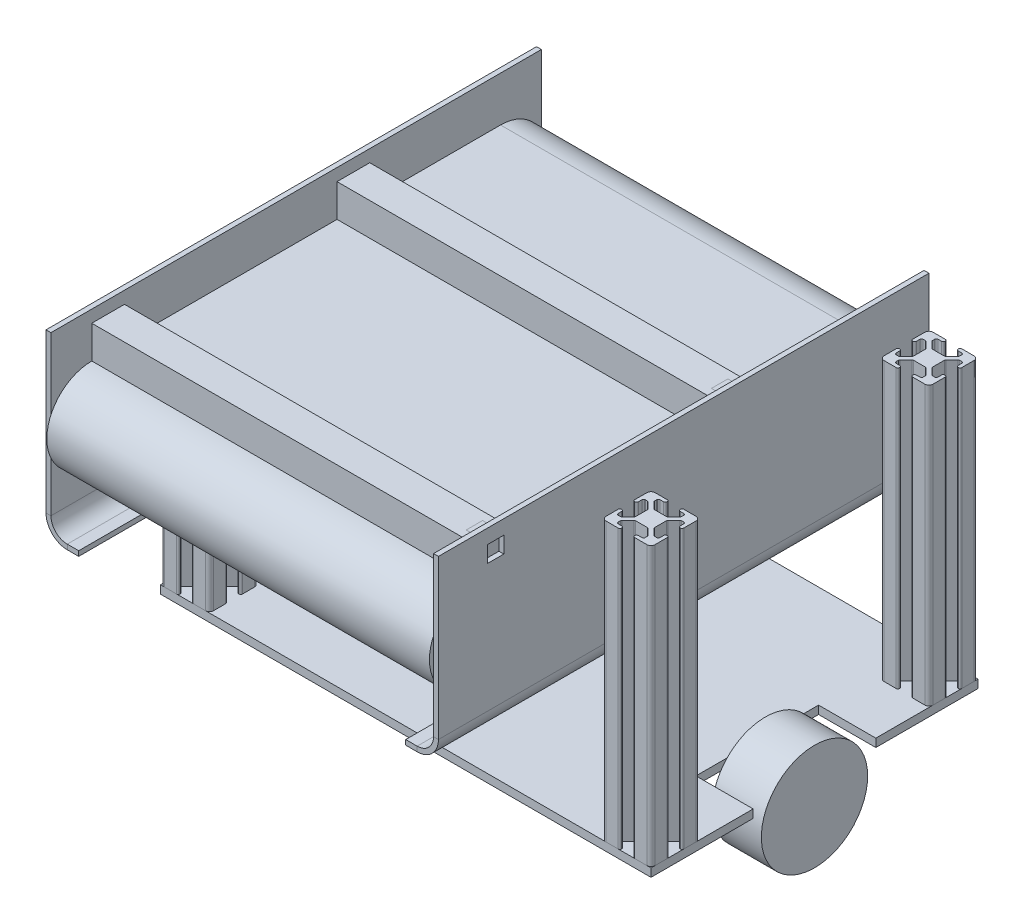
from build123d import *

# Parameters (mm, degrees)
BOSS_EXTRUDE1_DEPTH          = 5
BOSS_EXTRUDE2_DEPTH          = 170
MIRROR1_START                = 50
MIRROR1_DEPTH                = 170
SKETCH4_W                    = 3
SKETCH4_H                    = 300
BOSS_EXTRUDE3_DEPTH          = 110
EDGE_FLANGE1_STRIP_W         = 32
EDGE_FLANGE1_STRIP_H         = 3
EDGE_FLANGE1_STRIP_CUT_DEPTH = 300
EDGE_FLANGE1_DEPTH           = 300
SKETCH17_W                   = 234
SKETCH17_H                   = 5
BOSS_EXTRUDE4_START          = 150
SKETCH18_R                   = 32.5
BOSS_EXTRUDE4_DEPTH          = 30
SKETCH19_W                   = 10
SKETCH19_H                   = 10
CUT_EXTRUDE1_DEPTH           = 3
BOSS_EXTRUDE5_DEPTH          = 20
SKETCH20_3_W                 = 10
SKETCH20_3_H                 = 10
BOSS_EXTRUDE6_DEPTH          = 20
BODY_MOVE_COPY1_START        = 10
BODY_MOVE_COPY1_OUTLINE_W    = 10
BODY_MOVE_COPY1_OUTLINE_H    = 20
BODY_MOVE_COPY1_DEPTH        = 10
BODY_MOVE_COPY1_START_2      = -117
BODY_MOVE_COPY1_2_OUTLINE_W  = 20
BODY_MOVE_COPY1_2_OUTLINE_H  = 20
BODY_MOVE_COPY1_2_DEPTH      = 224
BODY_MOVE_COPY1_START_3      = 107
BODY_MOVE_COPY1_3_OUTLINE_W  = 20
BODY_MOVE_COPY1_3_OUTLINE_H  = 5
BODY_MOVE_COPY1_3_DEPTH      = 10


# Read off the part's stored shape, not the designer's step: Mirror1, Body-Move/Copy1
# Sheet-metal steps are written as plain solids
with BuildPart() as part:
    # Sketch1 → Boss-Extrude1 (new body)
    with BuildSketch(Plane(origin=(0, 50, 0), x_dir=(1, 0, 0), z_dir=(0, 1, 0))):
        Polygon((-150, -37.5), (-150, -100), (150, -100), (150, -37.5), (115, -37.5), (115, 37.5), (150, 37.5), (150, 100), (-150, 100), (-150, 37.5), (-115, 37.5), (-115, -37.5), align=None)
    extrude(amount=-BOSS_EXTRUDE1_DEPTH)


with BuildPart() as body_2:
    # Sketch2 → Boss-Extrude2 (new body)
    with BuildSketch(Plane(origin=(0, 50, 0), x_dir=(1, 0, 0), z_dir=(0, 1, 0))):
        with BuildLine():
            Line((120, -79.93), (120, -72.5))
            ThreePointArc((120, -72.5), (120.732233047, -70.732233047), (122.5, -70))
            Line((122.5, -70), (129.93, -70))
            ThreePointArc((129.93, -70), (130.637106781, -70.292893219), (130.93, -71))
            Line((130.93, -71), (130.93, -71.21))
            ThreePointArc((130.93, -71.21), (130.637106781, -71.917106781), (129.93, -72.21))
            Line((129.93, -72.21), (127.745, -72.21))
            ThreePointArc((127.745, -72.21), (127.037893219, -72.502893219), (126.745, -73.21))
            Line((126.745, -73.21), (126.745, -74.534735213))
            ThreePointArc((126.745, -74.534735213), (126.821120467, -74.917418646), (127.037893219, -75.241841995))
            Line((127.037893219, -75.241841995), (130.683158005, -78.887106781))
            ThreePointArc((130.683158005, -78.887106781), (131.007581354, -79.103879533), (131.390264787, -79.18))
            Line((131.390264787, -79.18), (138.609735213, -79.18))
            ThreePointArc((138.609735213, -79.18), (138.992418646, -79.103879533), (139.316841995, -78.887106781))
            Line((139.316841995, -78.887106781), (142.962106781, -75.241841995))
            ThreePointArc((142.962106781, -75.241841995), (143.178879533, -74.917418646), (143.255, -74.534735213))
            Line((143.255, -74.534735213), (143.255, -73.21))
            ThreePointArc((143.255, -73.21), (142.962106781, -72.502893219), (142.255, -72.21))
            Line((142.255, -72.21), (140.07, -72.21))
            ThreePointArc((140.07, -72.21), (139.362893219, -71.917106781), (139.07, -71.21))
            Line((139.07, -71.21), (139.07, -71))
            ThreePointArc((139.07, -71), (139.362893219, -70.292893219), (140.07, -70))
            Line((140.07, -70), (147.5, -70))
            ThreePointArc((147.5, -70), (149.267766953, -70.732233047), (150, -72.5))
            Line((150, -72.5), (150, -79.93))
            ThreePointArc((150, -79.93), (149.707106781, -80.637106781), (149, -80.93))
            Line((149, -80.93), (148.79, -80.93))
            ThreePointArc((148.79, -80.93), (148.082893219, -80.637106781), (147.79, -79.93))
            Line((147.79, -79.93), (147.79, -77.745))
            ThreePointArc((147.79, -77.745), (147.497106781, -77.037893219), (146.79, -76.745))
            Line((146.79, -76.745), (145.465264787, -76.745))
            ThreePointArc((145.465264787, -76.745), (145.082581354, -76.821120467), (144.758158005, -77.037893219))
            Line((144.758158005, -77.037893219), (141.112893219, -80.683158005))
            ThreePointArc((141.112893219, -80.683158005), (140.896120467, -81.007581354), (140.82, -81.390264787))
            Line((140.82, -81.390264787), (140.82, -88.609735213))
            ThreePointArc((140.82, -88.609735213), (140.896120467, -88.992418646), (141.112893219, -89.316841995))
            Line((141.112893219, -89.316841995), (144.758158005, -92.962106781))
            ThreePointArc((144.758158005, -92.962106781), (145.082581354, -93.178879533), (145.465264787, -93.255))
            Line((145.465264787, -93.255), (146.79, -93.255))
            ThreePointArc((146.79, -93.255), (147.497106781, -92.962106781), (147.79, -92.255))
            Line((147.79, -92.255), (147.79, -90.07))
            ThreePointArc((147.79, -90.07), (148.082893219, -89.362893219), (148.79, -89.07))
            Line((148.79, -89.07), (149, -89.07))
            ThreePointArc((149, -89.07), (149.707106781, -89.362893219), (150, -90.07))
            Line((150, -90.07), (150, -97.5))
            ThreePointArc((150, -97.5), (149.267766953, -99.267766953), (147.5, -100))
            Line((147.5, -100), (140.07, -100))
            ThreePointArc((140.07, -100), (139.362893219, -99.707106781), (139.07, -99))
            Line((139.07, -99), (139.07, -98.79))
            ThreePointArc((139.07, -98.79), (139.362893219, -98.082893219), (140.07, -97.79))
            Line((140.07, -97.79), (142.255, -97.79))
            ThreePointArc((142.255, -97.79), (142.962106781, -97.497106781), (143.255, -96.79))
            Line((143.255, -96.79), (143.255, -95.465264787))
            ThreePointArc((143.255, -95.465264787), (143.178879533, -95.082581354), (142.962106781, -94.758158005))
            Line((142.962106781, -94.758158005), (139.316841995, -91.112893219))
            ThreePointArc((139.316841995, -91.112893219), (138.992418646, -90.896120467), (138.609735213, -90.82))
            Line((138.609735213, -90.82), (131.390264787, -90.82))
            ThreePointArc((131.390264787, -90.82), (131.007581354, -90.896120467), (130.683158005, -91.112893219))
            Line((130.683158005, -91.112893219), (127.037893219, -94.758158005))
            ThreePointArc((127.037893219, -94.758158005), (126.821120467, -95.082581354), (126.745, -95.465264787))
            Line((126.745, -95.465264787), (126.745, -96.79))
            ThreePointArc((126.745, -96.79), (127.037893219, -97.497106781), (127.745, -97.79))
            Line((127.745, -97.79), (129.93, -97.79))
            ThreePointArc((129.93, -97.79), (130.637106781, -98.082893219), (130.93, -98.79))
            Line((130.93, -98.79), (130.93, -99))
            ThreePointArc((130.93, -99), (130.637106781, -99.707106781), (129.93, -100))
            Line((129.93, -100), (122.5, -100))
            ThreePointArc((122.5, -100), (120.732233047, -99.267766953), (120, -97.5))
            Line((120, -97.5), (120, -90.07))
            ThreePointArc((120, -90.07), (120.292893219, -89.362893219), (121, -89.07))
            Line((121, -89.07), (121.21, -89.07))
            ThreePointArc((121.21, -89.07), (121.917106781, -89.362893219), (122.21, -90.07))
            Line((122.21, -90.07), (122.21, -92.255))
            ThreePointArc((122.21, -92.255), (122.502893219, -92.962106781), (123.21, -93.255))
            Line((123.21, -93.255), (124.534735213, -93.255))
            ThreePointArc((124.534735213, -93.255), (124.917418646, -93.178879533), (125.241841995, -92.962106781))
            Line((125.241841995, -92.962106781), (128.887106781, -89.316841995))
            ThreePointArc((128.887106781, -89.316841995), (129.103879533, -88.992418646), (129.18, -88.609735213))
            Line((129.18, -88.609735213), (129.18, -81.390264787))
            ThreePointArc((129.18, -81.390264787), (129.103879533, -81.007581354), (128.887106781, -80.683158005))
            Line((128.887106781, -80.683158005), (125.241841995, -77.037893219))
            ThreePointArc((125.241841995, -77.037893219), (124.917418646, -76.821120467), (124.534735213, -76.745))
            Line((124.534735213, -76.745), (123.21, -76.745))
            ThreePointArc((123.21, -76.745), (122.502893219, -77.037893219), (122.21, -77.745))
            Line((122.21, -77.745), (122.21, -79.93))
            ThreePointArc((122.21, -79.93), (121.917106781, -80.637106781), (121.21, -80.93))
            Line((121.21, -80.93), (121, -80.93))
            ThreePointArc((121, -80.93), (120.292893219, -80.637106781), (120, -79.93))
        make_face()
    extrude(amount=BOSS_EXTRUDE2_DEPTH)


with BuildPart() as body_3:
    # Mirror1 outline → Mirror1 (new body)
    with BuildSketch(Plane(origin=(0, 0, 0), x_dir=(1, 0, 0), z_dir=(0, 1, 0)).offset(MIRROR1_START)):
        with BuildLine():
            ThreePointArc((-147.5, 100), (-149.267766953, 99.267766953), (-150, 97.5))
            Line((-150, 97.5), (-150, 90.07))
            ThreePointArc((-150, 90.07), (-149.707106781, 89.362893219), (-149, 89.07))
            Line((-149, 89.07), (-148.79, 89.07))
            ThreePointArc((-148.79, 89.07), (-148.082893219, 89.362893219), (-147.79, 90.07))
            Line((-147.79, 90.07), (-147.79, 92.255))
            ThreePointArc((-147.79, 92.255), (-147.497106781, 92.962106781), (-146.79, 93.255))
            Line((-146.79, 93.255), (-145.465264787, 93.255))
            ThreePointArc((-145.465264787, 93.255), (-145.082581354, 93.178879533), (-144.758158005, 92.962106781))
            Line((-144.758158005, 92.962106781), (-141.112893219, 89.316841995))
            ThreePointArc((-141.112893219, 89.316841995), (-140.896120467, 88.992418646), (-140.82, 88.609735213))
            Line((-140.82, 88.609735213), (-140.82, 81.390264787))
            ThreePointArc((-140.82, 81.390264787), (-140.896120467, 81.007581354), (-141.112893219, 80.683158005))
            Line((-141.112893219, 80.683158005), (-144.758158005, 77.037893219))
            ThreePointArc((-144.758158005, 77.037893219), (-145.082581354, 76.821120467), (-145.465264787, 76.745))
            Line((-145.465264787, 76.745), (-146.79, 76.745))
            ThreePointArc((-146.79, 76.745), (-147.497106781, 77.037893219), (-147.79, 77.745))
            Line((-147.79, 77.745), (-147.79, 79.93))
            ThreePointArc((-147.79, 79.93), (-148.082893219, 80.637106781), (-148.79, 80.93))
            Line((-148.79, 80.93), (-149, 80.93))
            ThreePointArc((-149, 80.93), (-149.707106781, 80.637106781), (-150, 79.93))
            Line((-150, 79.93), (-150, 72.5))
            ThreePointArc((-150, 72.5), (-149.267766953, 70.732233047), (-147.5, 70))
            Line((-147.5, 70), (-140.07, 70))
            ThreePointArc((-140.07, 70), (-139.362893219, 70.292893219), (-139.07, 71))
            Line((-139.07, 71), (-139.07, 71.21))
            ThreePointArc((-139.07, 71.21), (-139.362893219, 71.917106781), (-140.07, 72.21))
            Line((-140.07, 72.21), (-142.255, 72.21))
            ThreePointArc((-142.255, 72.21), (-142.962106781, 72.502893219), (-143.255, 73.21))
            Line((-143.255, 73.21), (-143.255, 74.534735213))
            ThreePointArc((-143.255, 74.534735213), (-143.178879533, 74.917418646), (-142.962106781, 75.241841995))
            Line((-142.962106781, 75.241841995), (-139.316841995, 78.887106781))
            ThreePointArc((-139.316841995, 78.887106781), (-138.992418646, 79.103879533), (-138.609735213, 79.18))
            Line((-138.609735213, 79.18), (-131.390264787, 79.18))
            ThreePointArc((-131.390264787, 79.18), (-131.007581354, 79.103879533), (-130.683158005, 78.887106781))
            Line((-130.683158005, 78.887106781), (-127.037893219, 75.241841995))
            ThreePointArc((-127.037893219, 75.241841995), (-126.821120467, 74.917418646), (-126.745, 74.534735213))
            Line((-126.745, 74.534735213), (-126.745, 73.21))
            ThreePointArc((-126.745, 73.21), (-127.037893219, 72.502893219), (-127.745, 72.21))
            Line((-127.745, 72.21), (-129.93, 72.21))
            ThreePointArc((-129.93, 72.21), (-130.637106781, 71.917106781), (-130.93, 71.21))
            Line((-130.93, 71.21), (-130.93, 71))
            ThreePointArc((-130.93, 71), (-130.637106781, 70.292893219), (-129.93, 70))
            Line((-129.93, 70), (-122.5, 70))
            ThreePointArc((-122.5, 70), (-120.732233047, 70.732233047), (-120, 72.5))
            Line((-120, 72.5), (-120, 79.93))
            ThreePointArc((-120, 79.93), (-120.292893219, 80.637106781), (-121, 80.93))
            Line((-121, 80.93), (-121.21, 80.93))
            ThreePointArc((-121.21, 80.93), (-121.917106781, 80.637106781), (-122.21, 79.93))
            Line((-122.21, 79.93), (-122.21, 77.745))
            ThreePointArc((-122.21, 77.745), (-122.502893219, 77.037893219), (-123.21, 76.745))
            Line((-123.21, 76.745), (-124.534735213, 76.745))
            ThreePointArc((-124.534735213, 76.745), (-124.917418646, 76.821120467), (-125.241841995, 77.037893219))
            Line((-125.241841995, 77.037893219), (-128.887106781, 80.683158005))
            ThreePointArc((-128.887106781, 80.683158005), (-129.103879533, 81.007581354), (-129.18, 81.390264787))
            Line((-129.18, 81.390264787), (-129.18, 88.609735213))
            ThreePointArc((-129.18, 88.609735213), (-129.103879533, 88.992418646), (-128.887106781, 89.316841995))
            Line((-128.887106781, 89.316841995), (-125.241841995, 92.962106781))
            ThreePointArc((-125.241841995, 92.962106781), (-124.917418646, 93.178879533), (-124.534735213, 93.255))
            Line((-124.534735213, 93.255), (-123.21, 93.255))
            ThreePointArc((-123.21, 93.255), (-122.502893219, 92.962106781), (-122.21, 92.255))
            Line((-122.21, 92.255), (-122.21, 90.07))
            ThreePointArc((-122.21, 90.07), (-121.917106781, 89.362893219), (-121.21, 89.07))
            Line((-121.21, 89.07), (-121, 89.07))
            ThreePointArc((-121, 89.07), (-120.292893219, 89.362893219), (-120, 90.07))
            Line((-120, 90.07), (-120, 97.5))
            ThreePointArc((-120, 97.5), (-120.732233047, 99.267766953), (-122.5, 100))
            Line((-122.5, 100), (-129.93, 100))
            ThreePointArc((-129.93, 100), (-130.637106781, 99.707106781), (-130.93, 99))
            Line((-130.93, 99), (-130.93, 98.79))
            ThreePointArc((-130.93, 98.79), (-130.637106781, 98.082893219), (-129.93, 97.79))
            Line((-129.93, 97.79), (-127.745, 97.79))
            ThreePointArc((-127.745, 97.79), (-127.037893219, 97.497106781), (-126.745, 96.79))
            Line((-126.745, 96.79), (-126.745, 95.465264787))
            ThreePointArc((-126.745, 95.465264787), (-126.821120467, 95.082581354), (-127.037893219, 94.758158005))
            Line((-127.037893219, 94.758158005), (-130.683158005, 91.112893219))
            ThreePointArc((-130.683158005, 91.112893219), (-131.007581354, 90.896120467), (-131.390264787, 90.82))
            Line((-131.390264787, 90.82), (-138.609735213, 90.82))
            ThreePointArc((-138.609735213, 90.82), (-138.992418646, 90.896120467), (-139.316841995, 91.112893219))
            Line((-139.316841995, 91.112893219), (-142.962106781, 94.758158005))
            ThreePointArc((-142.962106781, 94.758158005), (-143.178879533, 95.082581354), (-143.255, 95.465264787))
            Line((-143.255, 95.465264787), (-143.255, 96.79))
            ThreePointArc((-143.255, 96.79), (-142.962106781, 97.497106781), (-142.255, 97.79))
            Line((-142.255, 97.79), (-140.07, 97.79))
            ThreePointArc((-140.07, 97.79), (-139.362893219, 98.082893219), (-139.07, 98.79))
            Line((-139.07, 98.79), (-139.07, 99))
            ThreePointArc((-139.07, 99), (-139.362893219, 99.707106781), (-140.07, 100))
            Line((-140.07, 100), (-147.5, 100))
        make_face()
        with BuildLine():
            Line((-150, -90.07), (-150, -97.5))
            ThreePointArc((-150, -97.5), (-149.267766953, -99.267766953), (-147.5, -100))
            Line((-147.5, -100), (-140.07, -100))
            ThreePointArc((-140.07, -100), (-139.362893219, -99.707106781), (-139.07, -99))
            Line((-139.07, -99), (-139.07, -98.79))
            ThreePointArc((-139.07, -98.79), (-139.362893219, -98.082893219), (-140.07, -97.79))
            Line((-140.07, -97.79), (-142.255, -97.79))
            ThreePointArc((-142.255, -97.79), (-142.962106781, -97.497106781), (-143.255, -96.79))
            Line((-143.255, -96.79), (-143.255, -95.465264787))
            ThreePointArc((-143.255, -95.465264787), (-143.178879533, -95.082581354), (-142.962106781, -94.758158005))
            Line((-142.962106781, -94.758158005), (-139.316841995, -91.112893219))
            ThreePointArc((-139.316841995, -91.112893219), (-138.992418646, -90.896120467), (-138.609735213, -90.82))
            Line((-138.609735213, -90.82), (-131.390264787, -90.82))
            ThreePointArc((-131.390264787, -90.82), (-131.007581354, -90.896120467), (-130.683158005, -91.112893219))
            Line((-130.683158005, -91.112893219), (-127.037893219, -94.758158005))
            ThreePointArc((-127.037893219, -94.758158005), (-126.821120467, -95.082581354), (-126.745, -95.465264787))
            Line((-126.745, -95.465264787), (-126.745, -96.79))
            ThreePointArc((-126.745, -96.79), (-127.037893219, -97.497106781), (-127.745, -97.79))
            Line((-127.745, -97.79), (-129.93, -97.79))
            ThreePointArc((-129.93, -97.79), (-130.637106781, -98.082893219), (-130.93, -98.79))
            Line((-130.93, -98.79), (-130.93, -99))
            ThreePointArc((-130.93, -99), (-130.637106781, -99.707106781), (-129.93, -100))
            Line((-129.93, -100), (-122.5, -100))
            ThreePointArc((-122.5, -100), (-120.732233047, -99.267766953), (-120, -97.5))
            Line((-120, -97.5), (-120, -90.07))
            ThreePointArc((-120, -90.07), (-120.292893219, -89.362893219), (-121, -89.07))
            Line((-121, -89.07), (-121.21, -89.07))
            ThreePointArc((-121.21, -89.07), (-121.917106781, -89.362893219), (-122.21, -90.07))
            Line((-122.21, -90.07), (-122.21, -92.255))
            ThreePointArc((-122.21, -92.255), (-122.502893219, -92.962106781), (-123.21, -93.255))
            Line((-123.21, -93.255), (-124.534735213, -93.255))
            ThreePointArc((-124.534735213, -93.255), (-124.917418646, -93.178879533), (-125.241841995, -92.962106781))
            Line((-125.241841995, -92.962106781), (-128.887106781, -89.316841995))
            ThreePointArc((-128.887106781, -89.316841995), (-129.103879533, -88.992418646), (-129.18, -88.609735213))
            Line((-129.18, -88.609735213), (-129.18, -81.390264787))
            ThreePointArc((-129.18, -81.390264787), (-129.103879533, -81.007581354), (-128.887106781, -80.683158005))
            Line((-128.887106781, -80.683158005), (-125.241841995, -77.037893219))
            ThreePointArc((-125.241841995, -77.037893219), (-124.917418646, -76.821120467), (-124.534735213, -76.745))
            Line((-124.534735213, -76.745), (-123.21, -76.745))
            ThreePointArc((-123.21, -76.745), (-122.502893219, -77.037893219), (-122.21, -77.745))
            Line((-122.21, -77.745), (-122.21, -79.93))
            ThreePointArc((-122.21, -79.93), (-121.917106781, -80.637106781), (-121.21, -80.93))
            Line((-121.21, -80.93), (-121, -80.93))
            ThreePointArc((-121, -80.93), (-120.292893219, -80.637106781), (-120, -79.93))
            Line((-120, -79.93), (-120, -72.5))
            ThreePointArc((-120, -72.5), (-120.732233047, -70.732233047), (-122.5, -70))
            Line((-122.5, -70), (-129.93, -70))
            ThreePointArc((-129.93, -70), (-130.637106781, -70.292893219), (-130.93, -71))
            Line((-130.93, -71), (-130.93, -71.21))
            ThreePointArc((-130.93, -71.21), (-130.637106781, -71.917106781), (-129.93, -72.21))
            Line((-129.93, -72.21), (-127.745, -72.21))
            ThreePointArc((-127.745, -72.21), (-127.037893219, -72.502893219), (-126.745, -73.21))
            Line((-126.745, -73.21), (-126.745, -74.534735213))
            ThreePointArc((-126.745, -74.534735213), (-126.821120467, -74.917418646), (-127.037893219, -75.241841995))
            Line((-127.037893219, -75.241841995), (-130.683158005, -78.887106781))
            ThreePointArc((-130.683158005, -78.887106781), (-131.007581354, -79.103879533), (-131.390264787, -79.18))
            Line((-131.390264787, -79.18), (-138.609735213, -79.18))
            ThreePointArc((-138.609735213, -79.18), (-138.992418646, -79.103879533), (-139.316841995, -78.887106781))
            Line((-139.316841995, -78.887106781), (-142.962106781, -75.241841995))
            ThreePointArc((-142.962106781, -75.241841995), (-143.178879533, -74.917418646), (-143.255, -74.534735213))
            Line((-143.255, -74.534735213), (-143.255, -73.21))
            ThreePointArc((-143.255, -73.21), (-142.962106781, -72.502893219), (-142.255, -72.21))
            Line((-142.255, -72.21), (-140.07, -72.21))
            ThreePointArc((-140.07, -72.21), (-139.362893219, -71.917106781), (-139.07, -71.21))
            Line((-139.07, -71.21), (-139.07, -71))
            ThreePointArc((-139.07, -71), (-139.362893219, -70.292893219), (-140.07, -70))
            Line((-140.07, -70), (-147.5, -70))
            ThreePointArc((-147.5, -70), (-149.267766953, -70.732233047), (-150, -72.5))
            Line((-150, -72.5), (-150, -79.93))
            ThreePointArc((-150, -79.93), (-149.707106781, -80.637106781), (-149, -80.93))
            Line((-149, -80.93), (-148.79, -80.93))
            ThreePointArc((-148.79, -80.93), (-148.082893219, -80.637106781), (-147.79, -79.93))
            Line((-147.79, -79.93), (-147.79, -77.745))
            ThreePointArc((-147.79, -77.745), (-147.497106781, -77.037893219), (-146.79, -76.745))
            Line((-146.79, -76.745), (-145.465264787, -76.745))
            ThreePointArc((-145.465264787, -76.745), (-145.082581354, -76.821120467), (-144.758158005, -77.037893219))
            Line((-144.758158005, -77.037893219), (-141.112893219, -80.683158005))
            ThreePointArc((-141.112893219, -80.683158005), (-140.896120467, -81.007581354), (-140.82, -81.390264787))
            Line((-140.82, -81.390264787), (-140.82, -88.609735213))
            ThreePointArc((-140.82, -88.609735213), (-140.896120467, -88.992418646), (-141.112893219, -89.316841995))
            Line((-141.112893219, -89.316841995), (-144.758158005, -92.962106781))
            ThreePointArc((-144.758158005, -92.962106781), (-145.082581354, -93.178879533), (-145.465264787, -93.255))
            Line((-145.465264787, -93.255), (-146.79, -93.255))
            ThreePointArc((-146.79, -93.255), (-147.497106781, -92.962106781), (-147.79, -92.255))
            Line((-147.79, -92.255), (-147.79, -90.07))
            ThreePointArc((-147.79, -90.07), (-148.082893219, -89.362893219), (-148.79, -89.07))
            Line((-148.79, -89.07), (-149, -89.07))
            ThreePointArc((-149, -89.07), (-149.707106781, -89.362893219), (-150, -90.07))
        make_face()
        with BuildLine():
            Line((148.79, 89.07), (149, 89.07))
            ThreePointArc((149, 89.07), (149.707106781, 89.362893219), (150, 90.07))
            Line((150, 90.07), (150, 97.5))
            ThreePointArc((150, 97.5), (149.267766953, 99.267766953), (147.5, 100))
            Line((147.5, 100), (140.07, 100))
            ThreePointArc((140.07, 100), (139.362893219, 99.707106781), (139.07, 99))
            Line((139.07, 99), (139.07, 98.79))
            ThreePointArc((139.07, 98.79), (139.362893219, 98.082893219), (140.07, 97.79))
            Line((140.07, 97.79), (142.255, 97.79))
            ThreePointArc((142.255, 97.79), (142.962106781, 97.497106781), (143.255, 96.79))
            Line((143.255, 96.79), (143.255, 95.465264787))
            ThreePointArc((143.255, 95.465264787), (143.178879533, 95.082581354), (142.962106781, 94.758158005))
            Line((142.962106781, 94.758158005), (139.316841995, 91.112893219))
            ThreePointArc((139.316841995, 91.112893219), (138.992418646, 90.896120467), (138.609735213, 90.82))
            Line((138.609735213, 90.82), (131.390264787, 90.82))
            ThreePointArc((131.390264787, 90.82), (131.007581354, 90.896120467), (130.683158005, 91.112893219))
            Line((130.683158005, 91.112893219), (127.037893219, 94.758158005))
            ThreePointArc((127.037893219, 94.758158005), (126.821120467, 95.082581354), (126.745, 95.465264787))
            Line((126.745, 95.465264787), (126.745, 96.79))
            ThreePointArc((126.745, 96.79), (127.037893219, 97.497106781), (127.745, 97.79))
            Line((127.745, 97.79), (129.93, 97.79))
            ThreePointArc((129.93, 97.79), (130.637106781, 98.082893219), (130.93, 98.79))
            Line((130.93, 98.79), (130.93, 99))
            ThreePointArc((130.93, 99), (130.637106781, 99.707106781), (129.93, 100))
            Line((129.93, 100), (122.5, 100))
            ThreePointArc((122.5, 100), (120.732233047, 99.267766953), (120, 97.5))
            Line((120, 97.5), (120, 90.07))
            ThreePointArc((120, 90.07), (120.292893219, 89.362893219), (121, 89.07))
            Line((121, 89.07), (121.21, 89.07))
            ThreePointArc((121.21, 89.07), (121.917106781, 89.362893219), (122.21, 90.07))
            Line((122.21, 90.07), (122.21, 92.255))
            ThreePointArc((122.21, 92.255), (122.502893219, 92.962106781), (123.21, 93.255))
            Line((123.21, 93.255), (124.534735213, 93.255))
            ThreePointArc((124.534735213, 93.255), (124.917418646, 93.178879533), (125.241841995, 92.962106781))
            Line((125.241841995, 92.962106781), (128.887106781, 89.316841995))
            ThreePointArc((128.887106781, 89.316841995), (129.103879533, 88.992418646), (129.18, 88.609735213))
            Line((129.18, 88.609735213), (129.18, 81.390264787))
            ThreePointArc((129.18, 81.390264787), (129.103879533, 81.007581354), (128.887106781, 80.683158005))
            Line((128.887106781, 80.683158005), (125.241841995, 77.037893219))
            ThreePointArc((125.241841995, 77.037893219), (124.917418646, 76.821120467), (124.534735213, 76.745))
            Line((124.534735213, 76.745), (123.21, 76.745))
            ThreePointArc((123.21, 76.745), (122.502893219, 77.037893219), (122.21, 77.745))
            Line((122.21, 77.745), (122.21, 79.93))
            ThreePointArc((122.21, 79.93), (121.917106781, 80.637106781), (121.21, 80.93))
            Line((121.21, 80.93), (121, 80.93))
            ThreePointArc((121, 80.93), (120.292893219, 80.637106781), (120, 79.93))
            Line((120, 79.93), (120, 72.5))
            ThreePointArc((120, 72.5), (120.732233047, 70.732233047), (122.5, 70))
            Line((122.5, 70), (129.93, 70))
            ThreePointArc((129.93, 70), (130.637106781, 70.292893219), (130.93, 71))
            Line((130.93, 71), (130.93, 71.21))
            ThreePointArc((130.93, 71.21), (130.637106781, 71.917106781), (129.93, 72.21))
            Line((129.93, 72.21), (127.745, 72.21))
            ThreePointArc((127.745, 72.21), (127.037893219, 72.502893219), (126.745, 73.21))
            Line((126.745, 73.21), (126.745, 74.534735213))
            ThreePointArc((126.745, 74.534735213), (126.821120467, 74.917418646), (127.037893219, 75.241841995))
            Line((127.037893219, 75.241841995), (130.683158005, 78.887106781))
            ThreePointArc((130.683158005, 78.887106781), (131.007581354, 79.103879533), (131.390264787, 79.18))
            Line((131.390264787, 79.18), (138.609735213, 79.18))
            ThreePointArc((138.609735213, 79.18), (138.992418646, 79.103879533), (139.316841995, 78.887106781))
            Line((139.316841995, 78.887106781), (142.962106781, 75.241841995))
            ThreePointArc((142.962106781, 75.241841995), (143.178879533, 74.917418646), (143.255, 74.534735213))
            Line((143.255, 74.534735213), (143.255, 73.21))
            ThreePointArc((143.255, 73.21), (142.962106781, 72.502893219), (142.255, 72.21))
            Line((142.255, 72.21), (140.07, 72.21))
            ThreePointArc((140.07, 72.21), (139.362893219, 71.917106781), (139.07, 71.21))
            Line((139.07, 71.21), (139.07, 71))
            ThreePointArc((139.07, 71), (139.362893219, 70.292893219), (140.07, 70))
            Line((140.07, 70), (147.5, 70))
            ThreePointArc((147.5, 70), (149.267766953, 70.732233047), (150, 72.5))
            Line((150, 72.5), (150, 79.93))
            ThreePointArc((150, 79.93), (149.707106781, 80.637106781), (149, 80.93))
            Line((149, 80.93), (148.79, 80.93))
            ThreePointArc((148.79, 80.93), (148.082893219, 80.637106781), (147.79, 79.93))
            Line((147.79, 79.93), (147.79, 77.745))
            ThreePointArc((147.79, 77.745), (147.497106781, 77.037893219), (146.79, 76.745))
            Line((146.79, 76.745), (145.465264787, 76.745))
            ThreePointArc((145.465264787, 76.745), (145.082581354, 76.821120467), (144.758158005, 77.037893219))
            Line((144.758158005, 77.037893219), (141.112893219, 80.683158005))
            ThreePointArc((141.112893219, 80.683158005), (140.896120467, 81.007581354), (140.82, 81.390264787))
            Line((140.82, 81.390264787), (140.82, 88.609735213))
            ThreePointArc((140.82, 88.609735213), (140.896120467, 88.992418646), (141.112893219, 89.316841995))
            Line((141.112893219, 89.316841995), (144.758158005, 92.962106781))
            ThreePointArc((144.758158005, 92.962106781), (145.082581354, 93.178879533), (145.465264787, 93.255))
            Line((145.465264787, 93.255), (146.79, 93.255))
            ThreePointArc((146.79, 93.255), (147.497106781, 92.962106781), (147.79, 92.255))
            Line((147.79, 92.255), (147.79, 90.07))
            ThreePointArc((147.79, 90.07), (148.082893219, 89.362893219), (148.79, 89.07))
        make_face()
    extrude(amount=MIRROR1_DEPTH)


with BuildPart() as body_4:
    # Sketch4 → Boss-Extrude3 (new body)
    with BuildSketch(Plane(origin=(0, 250, 0), x_dir=(1, 0, 0), z_dir=(0, 1, 0))):
        with Locations((118.5, -50)):
            Rectangle(SKETCH4_W, SKETCH4_H)
    extrude(amount=-BOSS_EXTRUDE3_DEPTH)

    # Edge-Flange1 strip (across the edge) → Edge-Flange1 strip cut (cut)
    with BuildSketch(Plane(origin=(117, 140, -100), x_dir=(0, 1, 0), z_dir=(0, 0, 1))):
        with Locations((-3, -1.5)):
            Rectangle(EDGE_FLANGE1_STRIP_W, EDGE_FLANGE1_STRIP_H)
    extrude(amount=EDGE_FLANGE1_STRIP_CUT_DEPTH, mode=Mode.SUBTRACT)

    # Edge-Flange1 section (across the edge) → Edge-Flange1 (add)
    with BuildSketch(Plane(origin=(117, 140, -100), x_dir=(0, 1, 0), z_dir=(0, 0, 1))):
        with BuildLine():
            Line((0, 10), (0, 17))
            Line((0, 17), (3, 17))
            Line((3, 17), (3, 10))
            ThreePointArc((3, 10), (5.928932188, 2.928932188), (13, 0))
            Line((13, 0), (13, -3))
            ThreePointArc((13, -3), (3.807611845, 0.807611845), (0, 10))
        make_face()
    extrude(amount=EDGE_FLANGE1_DEPTH)


with BuildPart() as body_5:
    # Mirror2: mirrored copy
    add(body_4.part.mirror(Plane(origin=(0, 0, 0), x_dir=(0, 0, 1), z_dir=(1, 0, 0))))


with BuildPart() as body_6:
    # Sweep1: sweep along a path in Sketch16
    with BuildLine(Plane(origin=(0, 0, 0), x_dir=(0, 0, -1), z_dir=(1, 0, 0))) as sweep1_path:
        Line((-175, 170), (75, 170))
        ThreePointArc((75, 170), (100, 195), (75, 220))
        Line((75, 220), (-175, 220))
        ThreePointArc((-175, 220), (-200, 195), (-175, 170))
    # Sketch17 → Sweep1 (sweep)
    with BuildSketch(Plane.XY):
        with Locations((0, 220)):
            Rectangle(SKETCH17_W, SKETCH17_H)
    sweep(path=sweep1_path.line)


with BuildPart() as body_7:
    # Sketch18 → Boss-Extrude4 (new body)
    with BuildSketch(Plane(origin=(0, 0, 0), x_dir=(0, 0, -1), z_dir=(1, 0, 0)).offset(BOSS_EXTRUDE4_START)):
        with Locations((0, 32.5)):
            Circle(SKETCH18_R)
    extrude(amount=-BOSS_EXTRUDE4_DEPTH)


with BuildPart() as body_8:
    # Mirror3: mirrored copy
    add(body_7.part.mirror(Plane(origin=(0, 0, 0), x_dir=(0, 0, 1), z_dir=(1, 0, 0))))


with BuildPart() as body_4_1:
    add(body_4.part)

    # Sketch19 → Cut-Extrude1 (cut)
    with BuildSketch(Plane(origin=(120, 0, 0), x_dir=(0, 0, -1), z_dir=(1, 0, 0))):
        with Locations((-165, 236.25)):
            Rectangle(SKETCH19_W, SKETCH19_H)
    extrude(amount=-CUT_EXTRUDE1_DEPTH, mode=Mode.SUBTRACT)


with BuildPart() as body_9:
    # Sketch20 → Boss-Extrude5 (new body)
    with BuildSketch(Plane(origin=(0, 222.5, 0), x_dir=(1, 0, 0), z_dir=(0, 1, 0))):
        Polygon((117, -155), (-117, -155), (-117, -175), (117, -175), (117, -170), (107, -170), (107, -160), (117, -160), align=None)
    extrude(amount=BOSS_EXTRUDE5_DEPTH)


with BuildPart() as body_10:
    # Sketch20<3> → Boss-Extrude6 (new body)
    with BuildSketch(Plane(origin=(0, 222.5, 0), x_dir=(1, 0, 0), z_dir=(0, 1, 0))):
        with Locations((112, -165)):
            Rectangle(SKETCH20_3_W, SKETCH20_3_H)
    extrude(amount=BOSS_EXTRUDE6_DEPTH)


with BuildPart() as body_11:
    # Body-Move/Copy1 outline → Body-Move/Copy1 (new body)
    with BuildSketch(Plane.XY.offset(BODY_MOVE_COPY1_START)):
        with Locations((112, 232.5)):
            Rectangle(BODY_MOVE_COPY1_OUTLINE_W, BODY_MOVE_COPY1_OUTLINE_H)
    extrude(amount=BODY_MOVE_COPY1_DEPTH)


with BuildPart() as body_12:
    # Body-Move_Copy1 2 outline → Body-Move_Copy1 2 (new body)
    with BuildSketch(Plane.YZ.offset(BODY_MOVE_COPY1_START_2)):
        with Locations((232.5, 15)):
            Rectangle(BODY_MOVE_COPY1_2_OUTLINE_W, BODY_MOVE_COPY1_2_OUTLINE_H)
    extrude(amount=BODY_MOVE_COPY1_2_DEPTH)

    # Body-Move_Copy1 3 outline → Body-Move_Copy1 3 (add)
    with BuildSketch(Plane.YZ.offset(BODY_MOVE_COPY1_START_3)):
        with Locations((232.5, 7.5)):
            Rectangle(BODY_MOVE_COPY1_3_OUTLINE_W, BODY_MOVE_COPY1_3_OUTLINE_H)
        with Locations((232.5, 22.5)):
            Rectangle(BODY_MOVE_COPY1_3_OUTLINE_W, BODY_MOVE_COPY1_3_OUTLINE_H)
    extrude(amount=BODY_MOVE_COPY1_3_DEPTH)


solid = Compound([part.part, body_2.part, body_3.part, body_5.part, body_6.part, body_7.part, body_8.part, body_4_1.part, body_9.part, body_10.part, body_11.part, body_12.part])
